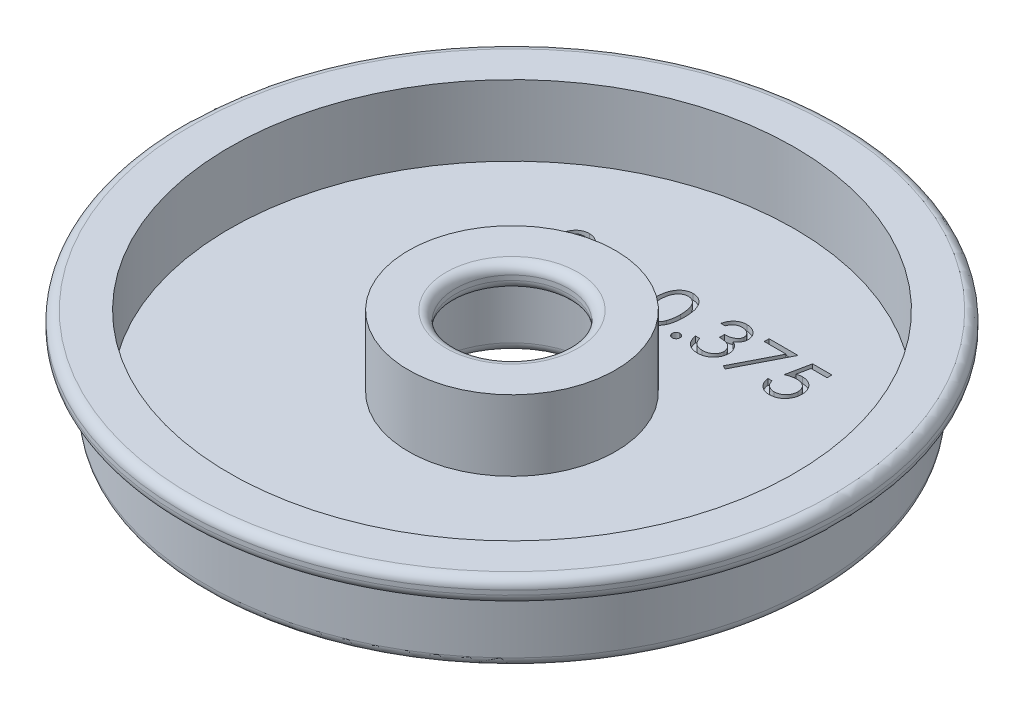
from build123d import *

# Parameters (mm, degrees)
CUT_EXTRUDE1_DEPTH = 0.79375


with BuildPart() as part:
    # Sketch1 → Revolve2 (revolve)
    with BuildSketch(Plane.XY):
        with BuildLine():
            Line((13.97, 6.386825196), (13.97, 15.911825196))
            Line((13.97, 15.911825196), (8.89, 15.911825196))
            ThreePointArc((8.89, 15.911825196), (7.991974388, 15.539850808), (7.62, 14.641825196))
            Line((7.62, 14.641825196), (7.62, 14.006825196))
            ThreePointArc((7.62, 14.006825196), (7.991974388, 13.108799584), (8.89, 12.736825196))
            Line((8.89, 12.736825196), (9.525, 12.736825196))
            ThreePointArc((9.525, 12.736825196), (10.423025612, 12.364850808), (10.795, 11.466825196))
            Line((10.795, 11.466825196), (10.795, 4.481825196))
            ThreePointArc((10.795, 4.481825196), (11.166974388, 3.583799584), (12.065, 3.211825196))
            Line((12.065, 3.211825196), (40.005, 3.211825196))
            ThreePointArc((40.005, 3.211825196), (40.903025612, 3.583799584), (41.275, 4.481825196))
            Line((41.275, 4.481825196), (41.275, 11.503650391))
            ThreePointArc((41.275, 11.503650391), (41.646974388, 12.401676004), (42.545, 12.773650391))
            Line((42.545, 12.773650391), (43.18, 12.773650391))
            ThreePointArc((43.18, 12.773650391), (44.078025612, 13.145624779), (44.45, 14.043650391))
            Line((44.45, 14.043650391), (44.45, 14.641825196))
            ThreePointArc((44.45, 14.641825196), (44.078025612, 15.539850808), (43.18, 15.911825196))
            Line((43.18, 15.911825196), (38.1, 15.911825196))
            Line((38.1, 15.911825196), (38.1, 6.386825196))
            Line((38.1, 6.386825196), (13.97, 6.386825196))
        make_face()
    revolve(axis=Axis((0, 0, 0), (0, 1, 0)))

    # Sketch2 → Cut-Extrude1 (cut)
    # profile 1 of 7: a face of its own
    with BuildSketch(Plane(origin=(0, 6.386825196, 0), x_dir=(1, 0, 0), z_dir=(0, 1, 0))):
        with BuildLine():
            Line((-14.587726894, 22.070934465), (-15.157598689, 22.070934465))
            add(Edge.make_bspline(
                [(-15.157598689, 22.070934465), (-15.142159932, 22.134856257), (-15.111978427, 22.259818133), (-15.049027115, 22.43835702), (-14.980448466, 22.607309695), (-14.898099662, 22.763512571), (-14.808276637, 22.910104866), (-14.705365413, 23.043761706), (-14.594113917, 23.167882372), (-14.47106008, 23.278033532), (-14.342012365, 23.37777884), (-14.205152412, 23.462823587), (-14.063233734, 23.535983122), (-13.91527305, 23.596254114), (-13.760829852, 23.641657564), (-13.601300393, 23.674599197), (-13.436266614, 23.695991647), (-13.324238843, 23.69807946), (-13.267354298, 23.699139593)],
                knots=[0, 0, 0, 0, 1.162005537, 2.271625781, 3.343758855, 4.383309926, 5.390229558, 6.379919256, 7.361854164, 8.333198761, 9.295911338, 10.242430842, 11.177959212, 12.116337295, 13.062827104, 14.020064771, 14.994644689, 16, 16, 16, 16], degree=3))
            add(Edge.make_bspline(
                [(-13.267354298, 23.699139593), (-13.184472751, 23.696637275), (-13.020517546, 23.691687222), (-12.779647446, 23.646485316), (-12.547370217, 23.574956862), (-12.326228296, 23.476125957), (-12.120817711, 23.354228974), (-11.938053487, 23.209150095), (-11.780412903, 23.043688505), (-11.648161675, 22.860930852), (-11.544611319, 22.665613), (-11.468254613, 22.464589857), (-11.421769563, 22.258338281), (-11.415745125, 22.119078646), (-11.412726894, 22.049309865)],
                knots=[0, 0, 0, 0, 1.083050992, 2.142477498, 3.193116406, 4.255571735, 5.30263384, 6.308962982, 7.297363603, 8.282367274, 9.249857812, 10.179914175, 11.08814088, 12, 12, 12, 12], degree=3))
            add(Edge.make_bspline(
                [(-11.412726894, 22.049309865), (-11.41483798, 21.982168966), (-11.418969049, 21.850784646), (-11.454045915, 21.658975644), (-11.513075992, 21.478197312), (-11.594845418, 21.307688632), (-11.700693659, 21.148530709), (-11.828914124, 21.000365449), (-11.98041181, 20.862535691), (-12.095217883, 20.783578933), (-12.154323448, 20.742929657)],
                knots=[0, 0, 0, 0, 1.024540389, 2.004866551, 2.965041327, 3.920577974, 4.882998113, 5.874504559, 6.905732034, 8, 8, 8, 8], degree=3))
            add(Edge.make_bspline(
                [(-12.154323448, 20.742929657), (-12.086774408, 20.710312117), (-11.952940222, 20.645687337), (-11.770512832, 20.518949034), (-11.604908687, 20.372615375), (-11.512554797, 20.258419419), (-11.466152374, 20.201042638)],
                knots=[0, 0, 0, 0, 1.015518401, 2.012035669, 3.001164323, 4, 4, 4, 4], degree=3))
            add(Edge.make_bspline(
                [(-11.466152374, 20.201042638), (-11.435597368, 20.159209288), (-11.374987713, 20.07622764), (-11.300174673, 19.942811553), (-11.232303852, 19.807916708), (-11.179417025, 19.6679275), (-11.138461581, 19.524466461), (-11.109186208, 19.377287256), (-11.090999553, 19.226269701), (-11.088395051, 19.124102773), (-11.087085868, 19.072747365)],
                knots=[0, 0, 0, 0, 1.025084078, 2.033381695, 3.024893161, 4.013698104, 4.991890475, 5.976764909, 6.982997093, 8, 8, 8, 8], degree=3))
            add(Edge.make_bspline(
                [(-11.087085868, 19.072747365), (-11.090341628, 18.983829728), (-11.096837827, 18.806412902), (-11.154902362, 18.544294478), (-11.244914956, 18.288071067), (-11.372743968, 18.043006716), (-11.528532163, 17.813716596), (-11.713874737, 17.608563864), (-11.926665792, 17.432217825), (-12.163984612, 17.284879268), (-12.421099974, 17.167099609), (-12.696101405, 17.085352534), (-12.985026503, 17.032110506), (-13.183159743, 17.026401187), (-13.283890756, 17.023498567)],
                knots=[0, 0, 0, 0, 0.955779014, 1.907060117, 2.875433937, 3.871313158, 4.872415639, 5.851225146, 6.836215519, 7.83643374, 8.849228613, 9.86973379, 10.916971861, 12, 12, 12, 12], degree=3))
            add(Edge.make_bspline(
                [(-13.283890756, 17.023498567), (-13.351780058, 17.025073754), (-13.485363566, 17.028173197), (-13.681748198, 17.049361516), (-13.869203281, 17.08806024), (-14.047982266, 17.140136237), (-14.218243975, 17.206161254), (-14.379468852, 17.288382321), (-14.532648801, 17.385104617), (-14.676338327, 17.497469841), (-14.8105203, 17.623165986), (-14.931628814, 17.764424475), (-15.041683009, 17.918634051), (-15.137736083, 18.087585882), (-15.224163125, 18.269096563), (-15.295248575, 18.465490267), (-15.35781525, 18.675011278), (-15.386904535, 18.821020893), (-15.401829458, 18.895934465)],
                knots=[0, 0, 0, 0, 1.048658725, 2.063410685, 3.046034179, 4.001477787, 4.936774919, 5.862367409, 6.792675028, 7.730719943, 8.675894397, 9.627829632, 10.600096036, 11.597688215, 12.626045268, 13.701542398, 14.82072376, 16, 16, 16, 16], degree=3))
            Line((-15.401829458, 18.895934465), (-14.831957663, 18.895934465))
            add(Edge.make_bspline(
                [(-14.831957663, 18.895934465), (-14.817110834, 18.847041255), (-14.788232463, 18.751939715), (-14.739075665, 18.615069446), (-14.6830718, 18.489596978), (-14.622992529, 18.374601885), (-14.559894491, 18.268951669), (-14.489291698, 18.175439993), (-14.416413392, 18.089959554), (-14.361477994, 18.041800044), (-14.334591878, 18.018230138)],
                knots=[0, 0, 0, 0, 1.198163088, 2.33053128, 3.407730985, 4.417276592, 5.372219308, 6.28897303, 7.162600585, 8, 8, 8, 8], degree=3))
            add(Edge.make_bspline(
                [(-14.334591878, 18.018230138), (-14.299038089, 17.990819303), (-14.228040258, 17.936082246), (-14.112346467, 17.866229291), (-13.990671602, 17.805702859), (-13.860379265, 17.759468154), (-13.724281038, 17.720320112), (-13.580177104, 17.694701456), (-13.42933881, 17.677124345), (-13.326345868, 17.675573255), (-13.273714474, 17.674780618)],
                knots=[0, 0, 0, 0, 0.946170439, 1.889420265, 2.845303464, 3.807233317, 4.801018734, 5.828864929, 6.890507805, 8, 8, 8, 8], degree=3))
            add(Edge.make_bspline(
                [(-13.273714474, 17.674780618), (-13.214290262, 17.675898046), (-13.098091345, 17.678083081), (-12.928537529, 17.698177577), (-12.767234017, 17.727442756), (-12.615971709, 17.772642025), (-12.472769217, 17.828487284), (-12.339633938, 17.898606534), (-12.214818146, 17.980874814), (-12.09992051, 18.074381574), (-11.996605089, 18.176746286), (-11.905637687, 18.283812858), (-11.828304372, 18.395129863), (-11.765922738, 18.511313311), (-11.716663882, 18.631882083), (-11.683130075, 18.757174531), (-11.659813755, 18.886165285), (-11.657914902, 18.973847843), (-11.656957663, 19.018049849)],
                knots=[0, 0, 0, 0, 1.217147791, 2.380027433, 3.494444702, 4.572153297, 5.609568379, 6.639424714, 7.649109417, 8.668170816, 9.669597737, 10.625200337, 11.543417969, 12.441394052, 13.322311151, 14.205496177, 15.095365482, 16, 16, 16, 16], degree=3))
            add(Edge.make_bspline(
                [(-11.656957663, 19.018049849), (-11.659734067, 19.077216135), (-11.66527306, 19.195254305), (-11.707561483, 19.368913332), (-11.777119137, 19.536232952), (-11.874496407, 19.694358457), (-11.993034086, 19.840909021), (-12.131581846, 19.971667282), (-12.291290203, 20.079563019), (-12.438283394, 20.154109581), (-12.568485892, 20.204976846), (-12.679910947, 20.238858567), (-12.80465507, 20.267549057), (-12.941209732, 20.294241321), (-13.090603853, 20.316958624), (-13.252674791, 20.335903061), (-13.427455387, 20.351061493), (-13.548452216, 20.357830765), (-13.610803817, 20.36131908)],
                knots=[0, 0, 0, 0, 1.07054697, 2.135767047, 3.216561865, 4.33974944, 5.486079747, 6.621378074, 7.775625952, 8.963672916, 9.598146892, 10.304877434, 11.070270905, 11.915000392, 12.823868403, 13.805723172, 14.86925407, 16, 16, 16, 16], degree=3))
            Line((-13.610803817, 20.36131908), (-13.610803817, 21.012601131))
            add(Edge.make_bspline(
                [(-13.610803817, 21.012601131), (-13.53224313, 21.013934275), (-13.378362044, 21.016545576), (-13.153582377, 21.048128681), (-12.93863794, 21.091817821), (-12.738292279, 21.158738098), (-12.555686756, 21.236462637), (-12.39726405, 21.326908788), (-12.265243654, 21.427446976), (-12.160267138, 21.539628996), (-12.081292681, 21.659943439), (-12.023549777, 21.785340804), (-11.989440613, 21.916920171), (-11.984887361, 22.00671764), (-11.982598689, 22.051853936)],
                knots=[0, 0, 0, 0, 1.321986639, 2.589447074, 3.816329219, 5.01088745, 6.139805852, 7.153945165, 8.075214402, 8.924034688, 9.728124013, 10.488707548, 11.240355623, 12, 12, 12, 12], degree=3))
            add(Edge.make_bspline(
                [(-11.982598689, 22.051853936), (-11.983350548, 22.085014988), (-11.984846338, 22.150987328), (-12.003709971, 22.247371381), (-12.032056445, 22.340808811), (-12.071026811, 22.430902267), (-12.123187886, 22.517026907), (-12.185610176, 22.599916993), (-12.259938015, 22.679099277), (-12.345110469, 22.752905), (-12.436571886, 22.823243473), (-12.536810764, 22.882958215), (-12.642804736, 22.934021399), (-12.754671153, 22.976130067), (-12.872773044, 23.007806204), (-12.996555513, 23.030549802), (-13.126254596, 23.044769547), (-13.214740452, 23.046816816), (-13.259722086, 23.047857541)],
                knots=[0, 0, 0, 0, 0.884392785, 1.759457502, 2.611959086, 3.489218968, 4.37281399, 5.2945488, 6.255912374, 7.266815255, 8.301784654, 9.332968512, 10.37626691, 11.440494194, 12.520033166, 13.637162961, 14.798855837, 16, 16, 16, 16], degree=3))
            add(Edge.make_bspline(
                [(-13.259722086, 23.047857541), (-13.332024398, 23.045333213), (-13.473247629, 23.040402613), (-13.67683755, 22.997217146), (-13.866102627, 22.928314052), (-14.010771351, 22.846067002), (-14.117601164, 22.764876929), (-14.193940752, 22.693970314), (-14.268907964, 22.615170762), (-14.337570835, 22.523624853), (-14.407010764, 22.425532248), (-14.470228754, 22.315906426), (-14.53165991, 22.197607025), (-14.568675964, 22.113976373), (-14.587726894, 22.070934465)],
                knots=[0, 0, 0, 0, 1.472543308, 2.876219568, 4.221790263, 5.565193594, 6.249813518, 6.953379497, 7.687249741, 8.463570142, 9.283606569, 10.136032583, 11.040678096, 12, 12, 12, 12], degree=3))
        make_face()
    # profile 2 of 7: a face of its own
    with BuildSketch(Plane(origin=(0, 6.386825196, 0), x_dir=(1, 0, 0), z_dir=(0, 1, 0))):
        Polygon((-8.074906381, 21.826703695), (-7.396911589, 21.826703695), (-6.202470483, 20.152705298), (-5.008029378, 21.826703695), (-4.330034586, 21.826703695), (-5.86283707, 19.678236147), (-4.085803817, 17.18631908), (-4.763798608, 17.18631908), (-6.202470483, 19.202494961), (-7.641142358, 17.18631908), (-8.31913715, 17.18631908), (-6.540831862, 19.678236147), align=None)
    # profile 3 of 7: a face of its own
    with BuildSketch(Plane(origin=(0, 6.386825196, 0), x_dir=(1, 0, 0), z_dir=(0, 1, 0))):
        with BuildLine():
            add(Edge.make_bspline(
                [(-1.399265355, 20.358775009), (-1.398670237, 20.460551699), (-1.39751421, 20.658254384), (-1.384653789, 20.946335092), (-1.363289954, 21.216591616), (-1.334012149, 21.469036893), (-1.298383242, 21.703736095), (-1.250820859, 21.920062011), (-1.196731917, 22.119015869), (-1.134043908, 22.301246443), (-1.06330892, 22.469208847), (-0.986321047, 22.626008855), (-0.90002492, 22.771409218), (-0.80935252, 22.907730637), (-0.710633476, 23.032741626), (-0.606677099, 23.1482076), (-0.493425981, 23.251459961), (-0.374729951, 23.345523967), (-0.249514366, 23.427982294), (-0.121348386, 23.50061312), (0.010650163, 23.562661451), (0.146841666, 23.611448384), (0.286002021, 23.651745206), (0.4286177, 23.679302297), (0.574924174, 23.69664126), (0.673678349, 23.698298914), (0.723761488, 23.699139593)],
                knots=[0, 0, 0, 0, 1.646270934, 3.197905019, 4.663502075, 6.030701355, 7.308322542, 8.50163776, 9.611534131, 10.641858119, 11.616356847, 12.558055219, 13.465016945, 14.349605745, 15.204443733, 16.039544428, 16.859896111, 17.680448484, 18.487036065, 19.28249412, 20.06191084, 20.843045899, 21.620316918, 22.403196591, 23.190181807, 24, 24, 24, 24], degree=3))
            add(Edge.make_bspline(
                [(0.723761488, 23.699139593), (0.774262999, 23.698254557), (0.874694615, 23.696494498), (1.023176439, 23.679578203), (1.168228004, 23.651509165), (1.309230913, 23.611738254), (1.447343388, 23.562397526), (1.581485156, 23.500553757), (1.712489433, 23.428564954), (1.838274383, 23.34397592), (1.9602209, 23.249665219), (2.075333632, 23.143052948), (2.18362306, 23.0252156), (2.286448257, 22.897413933), (2.380891983, 22.757196708), (2.470832353, 22.60700268), (2.551335904, 22.444205254), (2.628868814, 22.271520691), (2.695792348, 22.08417091), (2.756146821, 21.883211987), (2.80491295, 21.666270248), (2.845533487, 21.434483917), (2.877002084, 21.187001769), (2.899921306, 20.924354311), (2.912028189, 20.646368745), (2.914308204, 20.456308076), (2.915478235, 20.358775009)],
                knots=[0, 0, 0, 0, 0.810914788, 1.612654377, 2.396697861, 3.181598691, 3.963628158, 4.749916497, 5.551656086, 6.361998678, 7.18212741, 8.025565596, 8.878627764, 9.750805457, 10.657531673, 11.591944965, 12.560506719, 13.57287815, 14.630710178, 15.753379473, 16.941251878, 18.199788006, 19.531962791, 20.947069417, 22.433333509, 24, 24, 24, 24], degree=3))
            add(Edge.make_bspline(
                [(2.915478235, 20.358775009), (2.914296074, 20.261667348), (2.911992682, 20.072457029), (2.900057029, 19.79572226), (2.876546369, 19.534468667), (2.847136819, 19.288069685), (2.806404358, 19.057550862), (2.756320699, 18.842114506), (2.700712256, 18.640830262), (2.63206913, 18.455347103), (2.556938269, 18.283077549), (2.475195271, 18.122210009), (2.387620015, 17.971322592), (2.292209006, 17.831623051), (2.190512099, 17.702121773), (2.080352682, 17.585104658), (1.964836049, 17.477752153), (1.842530666, 17.382227057), (1.714783995, 17.298616055), (1.58422967, 17.223842355), (1.448551245, 17.163548751), (1.31082346, 17.111778034), (1.169076281, 17.072225785), (1.023486401, 17.044877504), (0.874794373, 17.025697151), (0.774280105, 17.024233966), (0.723761488, 17.023498567)],
                knots=[0, 0, 0, 0, 1.561518951, 3.042555995, 4.452378317, 5.7783523, 7.031515105, 8.214008947, 9.334062868, 10.386615937, 11.391082383, 12.354592575, 13.286541444, 14.194233754, 15.072674879, 15.931287219, 16.775624067, 17.606195743, 18.42308326, 19.229000347, 20.022332153, 20.807536673, 21.593273796, 22.3848459, 23.188221202, 24, 24, 24, 24], degree=3))
            add(Edge.make_bspline(
                [(0.723761488, 17.023498567), (0.673679738, 17.024344669), (0.574928303, 17.026013017), (0.42860176, 17.043273644), (0.286575041, 17.071024057), (0.148147302, 17.109879896), (0.012608338, 17.157441099), (-0.118194924, 17.219405639), (-0.245716865, 17.290768879), (-0.369617259, 17.372040572), (-0.487567894, 17.465152769), (-0.600232507, 17.568139407), (-0.704780756, 17.683570453), (-0.802088329, 17.809623256), (-0.894569889, 17.945138139), (-0.979640609, 18.09196533), (-1.05832773, 18.249522637), (-1.130252349, 18.41882799), (-1.194022067, 18.60235193), (-1.250351481, 18.802194011), (-1.294827166, 19.020118094), (-1.332896242, 19.254373888), (-1.363601909, 19.505968019), (-1.384564756, 19.775037074), (-1.397521142, 20.061413382), (-1.398673341, 20.257845686), (-1.399265355, 20.358775009)],
                knots=[0, 0, 0, 0, 0.810891512, 1.598919785, 2.382837074, 3.152667961, 3.926044502, 4.706494248, 5.493654104, 6.291793342, 7.103789334, 7.925228297, 8.761435821, 9.622817696, 10.50288917, 11.416980706, 12.369136599, 13.353924996, 14.394355917, 15.514179734, 16.714354668, 17.994756427, 19.357759367, 20.818452758, 22.365282078, 24, 24, 24, 24], degree=3))
        make_face()
        with BuildLine():
            add(Edge.make_bspline(
                [(-0.82939356, 20.36131908), (-0.829176849, 20.276503584), (-0.828756256, 20.111893359), (-0.817768577, 19.872692014), (-0.802800299, 19.649588704), (-0.783493946, 19.442300145), (-0.754822882, 19.251527979), (-0.72269771, 19.075960125), (-0.683603319, 18.91652571), (-0.637348072, 18.772130682), (-0.584662853, 18.640324514), (-0.527139358, 18.517676596), (-0.465343475, 18.402738082), (-0.396184445, 18.296541393), (-0.320864258, 18.198740209), (-0.241084203, 18.107603499), (-0.1538668, 18.026328976), (-0.03321001, 17.928853111), (0.12607788, 17.828125539), (0.326774991, 17.740411919), (0.533002038, 17.685289463), (0.672976449, 17.678279505), (0.742842017, 17.674780618)],
                knots=[0, 0, 0, 0, 1.459021318, 2.831673884, 4.118529203, 5.306027144, 6.411944654, 7.436330062, 8.375795394, 9.233974572, 10.042671642, 10.816086306, 11.563610507, 12.285937304, 12.993564865, 13.685989202, 14.367179055, 15.041617293, 16.353048772, 17.594441528, 18.799311195, 20, 20, 20, 20], degree=3))
            add(Edge.make_bspline(
                [(0.742842017, 17.674780618), (0.813159507, 17.677679449), (0.953649307, 17.683471126), (1.158906336, 17.739348835), (1.358169826, 17.823657857), (1.514328917, 17.923348331), (1.63313296, 18.018286872), (1.718253785, 18.099230591), (1.796380645, 18.189864807), (1.870479838, 18.28765353), (1.938441303, 18.394465037), (2.000241568, 18.509785709), (2.056635641, 18.633935789), (2.08876491, 18.720603744), (2.105191776, 18.764914833)],
                knots=[0, 0, 0, 0, 1.353760809, 2.704726607, 4.075137775, 5.516104923, 6.260822281, 7.007110065, 7.778089737, 8.566572457, 9.372053459, 10.217411131, 11.088608312, 12, 12, 12, 12], degree=3))
            add(Edge.make_bspline(
                [(2.105191776, 18.764914833), (2.124335698, 18.821574503), (2.163206069, 18.936617933), (2.213301716, 19.115077701), (2.252754083, 19.302317002), (2.288247618, 19.497216856), (2.312473877, 19.7012146), (2.331973481, 19.913679039), (2.343459156, 20.134770368), (2.344882919, 20.284984137), (2.34560644, 20.36131908)],
                knots=[0, 0, 0, 0, 0.884706709, 1.796334032, 2.740027952, 3.714592787, 4.726048262, 5.777819803, 6.87074269, 8, 8, 8, 8], degree=3))
            add(Edge.make_bspline(
                [(2.34560644, 20.36131908), (2.344608239, 20.437641676), (2.342655546, 20.586944989), (2.335191597, 20.805599402), (2.315917397, 21.013276626), (2.294510424, 21.210871341), (2.262946895, 21.397289747), (2.228914874, 21.574092444), (2.183192674, 21.739089074), (2.134352511, 21.894862887), (2.078453651, 22.039644074), (2.016920818, 22.174107658), (1.951204199, 22.298902802), (1.879826134, 22.41368711), (1.803633966, 22.518974723), (1.720616698, 22.612654631), (1.634067336, 22.697630273), (1.512841871, 22.794626648), (1.354138516, 22.893526439), (1.156661413, 22.98454146), (0.951156101, 23.036807934), (0.812229978, 23.044176995), (0.742842017, 23.047857541)],
                knots=[0, 0, 0, 0, 1.31362396, 2.569729283, 3.763502607, 4.902122613, 5.988968491, 7.01645872, 7.998833611, 8.933434873, 9.825090667, 10.667526885, 11.477055099, 12.250526234, 12.991942729, 13.710640831, 14.402115721, 15.076753259, 16.378508321, 17.609869233, 18.806226677, 20, 20, 20, 20], degree=3))
            add(Edge.make_bspline(
                [(0.742842017, 23.047857541), (0.672609942, 23.044171917), (0.532017848, 23.036793953), (0.324376559, 22.984736193), (0.125341521, 22.893998384), (-0.032942162, 22.794299079), (-0.154252175, 22.699342428), (-0.239673633, 22.616998433), (-0.319767402, 22.526925943), (-0.39355023, 22.428225326), (-0.462655072, 22.322152445), (-0.526120623, 22.207872829), (-0.583302064, 22.084807354), (-0.636069723, 21.953060393), (-0.682466067, 21.808677822), (-0.720736543, 21.649439791), (-0.756091625, 21.474430359), (-0.781120184, 21.282624966), (-0.803370141, 21.075284488), (-0.817669158, 20.85162421), (-0.828793011, 20.612021692), (-0.829189368, 20.446560361), (-0.82939356, 20.36131908)],
                knots=[0, 0, 0, 0, 1.207732386, 2.417664972, 3.655092373, 4.956220595, 5.625982001, 6.301752483, 6.994047911, 7.697131622, 8.419323945, 9.170223765, 9.943494443, 10.752040957, 11.610060368, 12.549350801, 13.567764191, 14.679664412, 15.874934091, 17.154273443, 18.533957287, 20, 20, 20, 20], degree=3))
        make_face(mode=Mode.SUBTRACT)
    # profile 4 of 7: a face of its own
    with BuildSketch(Plane(origin=(0, 6.386825196, 0), x_dir=(1, 0, 0), z_dir=(0, 1, 0))):
        with BuildLine():
            add(Edge.make_bspline(
                [(4.502978235, 18.163242157), (4.538339048, 18.161140912), (4.607659789, 18.157021666), (4.70787935, 18.128761129), (4.798583947, 18.078580417), (4.879378163, 18.011700804), (4.945974199, 17.930610101), (4.997943238, 17.840628953), (5.025957597, 17.739570349), (5.030046837, 17.669847939), (5.032144901, 17.63407549)],
                knots=[0, 0, 0, 0, 1.020151414, 1.999887582, 2.974338812, 3.990962822, 5.007586832, 5.987933904, 6.967670073, 8, 8, 8, 8], degree=3))
            add(Edge.make_bspline(
                [(5.032144901, 17.63407549), (5.02997574, 17.599162592), (5.025698186, 17.530314869), (4.998007454, 17.430018501), (4.945578134, 17.339981117), (4.879837504, 17.257790095), (4.798563974, 17.190768802), (4.70766491, 17.141015019), (4.607895056, 17.110730998), (4.538378298, 17.106873288), (4.502978235, 17.104908824)],
                knots=[0, 0, 0, 0, 1.009421747, 1.99056486, 2.972319754, 3.999869655, 5.017953583, 5.993804169, 6.978383603, 8, 8, 8, 8], degree=3))
            add(Edge.make_bspline(
                [(4.502978235, 17.104908824), (4.467552663, 17.106802207), (4.398392667, 17.110498587), (4.298995221, 17.141636822), (4.207542578, 17.190302242), (4.126284872, 17.257915064), (4.059993645, 17.339558181), (4.009873308, 17.430638583), (3.979774037, 17.530027763), (3.975815497, 17.599106043), (3.973811568, 17.63407549)],
                knots=[0, 0, 0, 0, 1.022052826, 1.995314843, 2.982371812, 4.00089066, 5.028879526, 6.005146991, 6.990147033, 8, 8, 8, 8], degree=3))
            add(Edge.make_bspline(
                [(3.973811568, 17.63407549), (3.975738519, 17.669906508), (3.979500656, 17.739862172), (4.009936496, 17.840009124), (4.059604767, 17.931029006), (4.126743126, 18.011577087), (4.20752292, 18.079045479), (4.298774607, 18.128148747), (4.398632058, 18.157250638), (4.467592947, 18.161210347), (4.502978235, 18.163242157)],
                knots=[0, 0, 0, 0, 1.032775665, 2.016367738, 2.991239715, 4.008302682, 5.025365648, 6.011011707, 6.979408107, 8, 8, 8, 8], degree=3))
        make_face()
    # profile 5 of 7: a face of its own
    with BuildSketch(Plane(origin=(0, 6.386825196, 0), x_dir=(1, 0, 0), z_dir=(0, 1, 0))):
        with BuildLine():
            Line((6.660350029, 22.070934465), (6.090478235, 22.070934465))
            add(Edge.make_bspline(
                [(6.090478235, 22.070934465), (6.105916991, 22.134856257), (6.136098496, 22.259818133), (6.199049808, 22.43835702), (6.267628457, 22.607309695), (6.349977261, 22.763512571), (6.439800287, 22.910104866), (6.54271151, 23.043761706), (6.653963007, 23.167882372), (6.777016843, 23.278033532), (6.906064558, 23.37777884), (7.042924511, 23.462823587), (7.184843189, 23.535983122), (7.332803873, 23.596254114), (7.487247071, 23.641657564), (7.64677653, 23.674599197), (7.811810309, 23.695991647), (7.92383808, 23.69807946), (7.980722626, 23.699139593)],
                knots=[0, 0, 0, 0, 1.162005537, 2.271625781, 3.343758855, 4.383309926, 5.390229558, 6.379919256, 7.361854164, 8.333198761, 9.295911338, 10.242430842, 11.177959212, 12.116337295, 13.062827104, 14.020064771, 14.994644689, 16, 16, 16, 16], degree=3))
            add(Edge.make_bspline(
                [(7.980722626, 23.699139593), (8.063604172, 23.696637275), (8.227559377, 23.691687222), (8.468429477, 23.646485316), (8.700706706, 23.574956862), (8.921848627, 23.476125957), (9.127259212, 23.354228974), (9.310023436, 23.209150095), (9.46766402, 23.043688505), (9.599915248, 22.860930852), (9.703465604, 22.665613), (9.77982231, 22.464589857), (9.82630736, 22.258338281), (9.832331798, 22.119078646), (9.835350029, 22.049309865)],
                knots=[0, 0, 0, 0, 1.083050992, 2.142477498, 3.193116406, 4.255571735, 5.30263384, 6.308962982, 7.297363603, 8.282367274, 9.249857812, 10.179914175, 11.08814088, 12, 12, 12, 12], degree=3))
            add(Edge.make_bspline(
                [(9.835350029, 22.049309865), (9.833238943, 21.982168966), (9.829107874, 21.850784646), (9.794031008, 21.658975644), (9.735000931, 21.478197312), (9.653231505, 21.307688632), (9.547383264, 21.148530709), (9.419162799, 21.000365449), (9.267665113, 20.862535691), (9.15285904, 20.783578933), (9.093753475, 20.742929657)],
                knots=[0, 0, 0, 0, 1.024540389, 2.004866551, 2.965041327, 3.920577974, 4.882998113, 5.874504559, 6.905732034, 8, 8, 8, 8], degree=3))
            add(Edge.make_bspline(
                [(9.093753475, 20.742929657), (9.161302515, 20.710312117), (9.295136702, 20.645687337), (9.477564091, 20.518949034), (9.643168236, 20.372615375), (9.735522126, 20.258419419), (9.781924549, 20.201042638)],
                knots=[0, 0, 0, 0, 1.015518401, 2.012035669, 3.001164323, 4, 4, 4, 4], degree=3))
            add(Edge.make_bspline(
                [(9.781924549, 20.201042638), (9.812479555, 20.159209288), (9.87308921, 20.07622764), (9.94790225, 19.942811553), (10.015773071, 19.807916708), (10.068659898, 19.6679275), (10.109615342, 19.524466461), (10.138890715, 19.377287256), (10.15707737, 19.226269701), (10.159681872, 19.124102773), (10.160991055, 19.072747365)],
                knots=[0, 0, 0, 0, 1.025084078, 2.033381695, 3.024893161, 4.013698104, 4.991890475, 5.976764909, 6.982997093, 8, 8, 8, 8], degree=3))
            add(Edge.make_bspline(
                [(10.160991055, 19.072747365), (10.157735295, 18.983829728), (10.151239096, 18.806412902), (10.093174561, 18.544294478), (10.003161967, 18.288071067), (9.875332955, 18.043006716), (9.71954476, 17.813716596), (9.534202186, 17.608563864), (9.321411131, 17.432217825), (9.084092311, 17.284879268), (8.826976949, 17.167099609), (8.551975518, 17.085352534), (8.26305042, 17.032110506), (8.064917181, 17.026401187), (7.964186167, 17.023498567)],
                knots=[0, 0, 0, 0, 0.955779014, 1.907060117, 2.875433937, 3.871313158, 4.872415639, 5.851225146, 6.836215519, 7.83643374, 8.849228613, 9.86973379, 10.916971861, 12, 12, 12, 12], degree=3))
            add(Edge.make_bspline(
                [(7.964186167, 17.023498567), (7.896296865, 17.025073754), (7.762713358, 17.028173197), (7.566328725, 17.049361516), (7.378873642, 17.08806024), (7.200094657, 17.140136237), (7.029832948, 17.206161254), (6.868608071, 17.288382321), (6.715428122, 17.385104617), (6.571738596, 17.497469841), (6.437556623, 17.623165986), (6.316448109, 17.764424475), (6.206393914, 17.918634051), (6.110340841, 18.087585882), (6.023913798, 18.269096563), (5.952828348, 18.465490267), (5.890261673, 18.675011278), (5.861172388, 18.821020893), (5.846247465, 18.895934465)],
                knots=[0, 0, 0, 0, 1.048658725, 2.063410685, 3.046034179, 4.001477787, 4.936774919, 5.862367409, 6.792675028, 7.730719943, 8.675894397, 9.627829632, 10.600096036, 11.597688215, 12.626045268, 13.701542398, 14.82072376, 16, 16, 16, 16], degree=3))
            Line((5.846247465, 18.895934465), (6.41611926, 18.895934465))
            add(Edge.make_bspline(
                [(6.41611926, 18.895934465), (6.430966089, 18.847041255), (6.45984446, 18.751939715), (6.509001258, 18.615069446), (6.565005123, 18.489596978), (6.625084394, 18.374601885), (6.688182432, 18.268951669), (6.758785225, 18.175439993), (6.831663531, 18.089959554), (6.886598929, 18.041800044), (6.913485045, 18.018230138)],
                knots=[0, 0, 0, 0, 1.198163088, 2.33053128, 3.407730985, 4.417276592, 5.372219308, 6.28897303, 7.162600585, 8, 8, 8, 8], degree=3))
            add(Edge.make_bspline(
                [(6.913485045, 18.018230138), (6.949038834, 17.990819303), (7.020036666, 17.936082246), (7.135730456, 17.866229291), (7.257405321, 17.805702859), (7.387697658, 17.759468154), (7.523795885, 17.720320112), (7.667899819, 17.694701456), (7.818738113, 17.677124345), (7.921731055, 17.675573255), (7.974362449, 17.674780618)],
                knots=[0, 0, 0, 0, 0.946170439, 1.889420265, 2.845303464, 3.807233317, 4.801018734, 5.828864929, 6.890507805, 8, 8, 8, 8], degree=3))
            add(Edge.make_bspline(
                [(7.974362449, 17.674780618), (8.033786661, 17.675898046), (8.149985578, 17.678083081), (8.319539394, 17.698177577), (8.480842906, 17.727442756), (8.632105214, 17.772642025), (8.775307706, 17.828487284), (8.908442985, 17.898606534), (9.033258777, 17.980874814), (9.148156413, 18.074381574), (9.251471834, 18.176746286), (9.342439236, 18.283812858), (9.419772551, 18.395129863), (9.482154185, 18.511313311), (9.531413041, 18.631882083), (9.564946848, 18.757174531), (9.588263168, 18.886165285), (9.590162022, 18.973847843), (9.59111926, 19.018049849)],
                knots=[0, 0, 0, 0, 1.217147791, 2.380027433, 3.494444702, 4.572153297, 5.609568379, 6.639424714, 7.649109417, 8.668170816, 9.669597737, 10.625200337, 11.543417969, 12.441394052, 13.322311151, 14.205496177, 15.095365482, 16, 16, 16, 16], degree=3))
            add(Edge.make_bspline(
                [(9.59111926, 19.018049849), (9.588342856, 19.077216135), (9.582803863, 19.195254305), (9.54051544, 19.368913332), (9.470957786, 19.536232952), (9.373580516, 19.694358457), (9.255042837, 19.840909021), (9.116495077, 19.971667282), (8.95678672, 20.079563019), (8.809793529, 20.154109581), (8.679591031, 20.204976846), (8.568165976, 20.238858567), (8.443421853, 20.267549057), (8.306867191, 20.294241321), (8.15747307, 20.316958624), (7.995402132, 20.335903061), (7.820621536, 20.351061493), (7.699624707, 20.357830765), (7.637273106, 20.36131908)],
                knots=[0, 0, 0, 0, 1.07054697, 2.135767047, 3.216561865, 4.33974944, 5.486079747, 6.621378074, 7.775625952, 8.963672916, 9.598146892, 10.304877434, 11.070270905, 11.915000392, 12.823868403, 13.805723172, 14.86925407, 16, 16, 16, 16], degree=3))
            Line((7.637273106, 20.36131908), (7.637273106, 21.012601131))
            add(Edge.make_bspline(
                [(7.637273106, 21.012601131), (7.715833793, 21.013934275), (7.869714879, 21.016545576), (8.094494546, 21.048128681), (8.309438984, 21.091817821), (8.509784644, 21.158738098), (8.692390167, 21.236462637), (8.850812873, 21.326908788), (8.982833269, 21.427446976), (9.087809785, 21.539628996), (9.166784242, 21.659943439), (9.224527146, 21.785340804), (9.25863631, 21.916920171), (9.263189562, 22.00671764), (9.265478235, 22.051853936)],
                knots=[0, 0, 0, 0, 1.321986639, 2.589447074, 3.816329219, 5.01088745, 6.139805852, 7.153945165, 8.075214402, 8.924034688, 9.728124013, 10.488707548, 11.240355623, 12, 12, 12, 12], degree=3))
            add(Edge.make_bspline(
                [(9.265478235, 22.051853936), (9.264726375, 22.085014988), (9.263230585, 22.150987328), (9.244366953, 22.247371381), (9.216020478, 22.340808811), (9.177050112, 22.430902267), (9.124889037, 22.517026907), (9.062466748, 22.599916993), (8.988138908, 22.679099277), (8.902966455, 22.752905), (8.811505037, 22.823243473), (8.711266159, 22.882958215), (8.605272187, 22.934021399), (8.49340577, 22.976130067), (8.375303879, 23.007806204), (8.25152141, 23.030549802), (8.121822327, 23.044769547), (8.033336471, 23.046816816), (7.988354837, 23.047857541)],
                knots=[0, 0, 0, 0, 0.884392785, 1.759457502, 2.611959086, 3.489218968, 4.37281399, 5.2945488, 6.255912374, 7.266815255, 8.301784654, 9.332968512, 10.37626691, 11.440494194, 12.520033166, 13.637162961, 14.798855837, 16, 16, 16, 16], degree=3))
            add(Edge.make_bspline(
                [(7.988354837, 23.047857541), (7.916052525, 23.045333213), (7.774829294, 23.040402613), (7.571239373, 22.997217146), (7.381974296, 22.928314052), (7.237305572, 22.846067002), (7.130475759, 22.764876929), (7.054136171, 22.693970314), (6.979168959, 22.615170762), (6.910506088, 22.523624853), (6.841066159, 22.425532248), (6.777848169, 22.315906426), (6.716417013, 22.197607025), (6.679400959, 22.113976373), (6.660350029, 22.070934465)],
                knots=[0, 0, 0, 0, 1.472543308, 2.876219568, 4.221790263, 5.565193594, 6.249813518, 6.953379497, 7.687249741, 8.463570142, 9.283606569, 10.136032583, 11.040678096, 12, 12, 12, 12], degree=3))
        make_face()
    # profile 6 of 7: a face of its own
    with BuildSketch(Plane(origin=(0, 6.386825196, 0), x_dir=(1, 0, 0), z_dir=(0, 1, 0))):
        Polygon((11.137914132, 23.53631908), (15.04560644, 23.53631908), (11.707785927, 17.023498567), (11.215508283, 17.294442077), (14.081403715, 22.885037029), (11.137914132, 22.885037029), align=None)
    # profile 7 of 7: a face of its own
    with BuildSketch(Plane(origin=(0, 6.386825196, 0), x_dir=(1, 0, 0), z_dir=(0, 1, 0))):
        with BuildLine():
            Line((19.604580799, 23.53631908), (19.604580799, 22.885037029))
            Line((19.604580799, 22.885037029), (17.444664933, 22.885037029))
            Line((17.444664933, 22.885037029), (17.102487449, 21.214854737))
            add(Edge.make_bspline(
                [(17.102487449, 21.214854737), (17.169717393, 21.233415373), (17.299964775, 21.26937367), (17.492206237, 21.309298425), (17.674709235, 21.33336573), (17.793137407, 21.336651965), (17.85044418, 21.338242157)],
                knots=[0, 0, 0, 0, 1.100273476, 2.13160584, 3.095893838, 4, 4, 4, 4], degree=3))
            add(Edge.make_bspline(
                [(17.85044418, 21.338242157), (17.921353251, 21.336707388), (18.0607782, 21.333689648), (18.264774575, 21.30471215), (18.45950711, 21.259101162), (18.644568553, 21.195382501), (18.820301267, 21.113903414), (18.985088414, 21.012122094), (19.141403485, 20.893225907), (19.286442191, 20.756528528), (19.418022007, 20.606085024), (19.533711731, 20.444327172), (19.631978145, 20.272826985), (19.7110098, 20.08994588), (19.774118521, 19.897705702), (19.816122854, 19.694083731), (19.844093169, 19.480999284), (19.84721807, 19.33530385), (19.848811568, 19.261008583)],
                knots=[0, 0, 0, 0, 1.052922333, 2.070308379, 3.05430497, 4.020497103, 4.973039431, 5.925935799, 6.892292201, 7.88610001, 8.88166317, 9.857072816, 10.836096531, 11.812156883, 12.81219415, 13.836441305, 14.89672472, 16, 16, 16, 16], degree=3))
            add(Edge.make_bspline(
                [(19.848811568, 19.261008583), (19.847604931, 19.209261126), (19.845207965, 19.106465534), (19.833018527, 18.953803913), (19.809549442, 18.804374202), (19.778039429, 18.658156577), (19.737141042, 18.515427858), (19.687630901, 18.375779515), (19.627040965, 18.240080728), (19.560581185, 18.107047512), (19.485748289, 17.979687363), (19.402692997, 17.860581345), (19.314944177, 17.74794272), (19.220526235, 17.642979518), (19.118561572, 17.546381471), (19.010285061, 17.457575304), (18.896560699, 17.375059176), (18.775629045, 17.302182593), (18.650184826, 17.23512123), (18.51841649, 17.180105669), (18.383323504, 17.130919425), (18.242961516, 17.091713568), (18.097648456, 17.060993076), (17.947144792, 17.040127701), (17.792239862, 17.02493045), (17.687238053, 17.023979117), (17.634198186, 17.023498567)],
                knots=[0, 0, 0, 0, 1.056347294, 2.098418968, 3.122841568, 4.141288669, 5.149314143, 6.15115421, 7.162517403, 8.180376062, 9.185164535, 10.17417709, 11.141909838, 12.097768115, 13.052685741, 14.0056014, 14.954263652, 15.917497458, 16.885230207, 17.854509472, 18.828990115, 19.81800267, 20.826176721, 21.857883937, 22.917946725, 24, 24, 24, 24], degree=3))
            add(Edge.make_bspline(
                [(17.634198186, 17.023498567), (17.570926459, 17.024751945), (17.446446809, 17.027217817), (17.26407378, 17.053014211), (17.088605852, 17.089960174), (16.921455526, 17.145543121), (16.761124805, 17.215188641), (16.60977216, 17.303210838), (16.463530252, 17.40295864), (16.328344128, 17.520670138), (16.202875179, 17.649331447), (16.090559084, 17.788954596), (15.990531024, 17.937235155), (15.904392826, 18.094893235), (15.830917844, 18.261514569), (15.773196365, 18.437723442), (15.726608493, 18.622599164), (15.706899144, 18.749877675), (15.696888491, 18.814524208)],
                knots=[0, 0, 0, 0, 1.0467383, 2.05933395, 3.04377827, 4.011590433, 4.970194871, 5.932262533, 6.905835911, 7.896367577, 8.894135286, 9.877477877, 10.858688626, 11.851381753, 12.8477658, 13.868841284, 14.917554742, 16, 16, 16, 16], degree=3))
            Line((15.696888491, 18.814524208), (16.266760286, 18.814524208))
            add(Edge.make_bspline(
                [(16.266760286, 18.814524208), (16.280782097, 18.753969787), (16.307732797, 18.637580828), (16.366888941, 18.474056823), (16.439217029, 18.328334803), (16.525222062, 18.19848713), (16.627819974, 18.085259378), (16.744894795, 17.984354137), (16.876154236, 17.893322117), (17.022010524, 17.817443668), (17.175885682, 17.752730358), (17.336934763, 17.709637997), (17.500772649, 17.679337806), (17.611586263, 17.676304754), (17.667271103, 17.674780618)],
                knots=[0, 0, 0, 0, 1.136247022, 2.183929868, 3.172523383, 4.106158343, 5.02341133, 5.958108904, 6.928429099, 7.938127109, 8.96079061, 9.975095812, 10.982467395, 12, 12, 12, 12], degree=3))
            add(Edge.make_bspline(
                [(17.667271103, 17.674780618), (17.721624281, 17.676269744), (17.828646133, 17.679201845), (17.986146791, 17.701769766), (18.138207292, 17.736527074), (18.28332721, 17.788542383), (18.424046004, 17.851760658), (18.55680413, 17.932886581), (18.685442207, 18.026249757), (18.805961821, 18.133213929), (18.916341964, 18.251087518), (19.013870927, 18.37713936), (19.095109041, 18.511608496), (19.163569496, 18.65216693), (19.215554767, 18.80035517), (19.252640547, 18.95547873), (19.274417525, 19.117920766), (19.277413237, 19.228717942), (19.278939773, 19.285177253)],
                knots=[0, 0, 0, 0, 1.027316725, 2.022795036, 3.002884548, 3.971462791, 4.93288096, 5.914575861, 6.907176829, 7.935150275, 8.956128384, 9.956726525, 10.942570165, 11.921478529, 12.907843606, 13.90538589, 14.932640048, 16, 16, 16, 16], degree=3))
            add(Edge.make_bspline(
                [(19.278939773, 19.285177253), (19.277745103, 19.336114688), (19.275406707, 19.43581747), (19.256301244, 19.581684601), (19.223069022, 19.719702835), (19.17694284, 19.85053866), (19.11837859, 19.974315477), (19.046811709, 20.091161029), (18.960899116, 20.199535269), (18.862760975, 20.299488902), (18.755249958, 20.391736032), (18.636516311, 20.470374589), (18.509044729, 20.536530554), (18.374371028, 20.593622494), (18.229291854, 20.634626703), (18.07668025, 20.665411295), (17.914888223, 20.683219168), (17.804269974, 20.685690022), (17.747409324, 20.686960106)],
                knots=[0, 0, 0, 0, 1.045622112, 2.046656509, 3.013763289, 3.955457236, 4.890082067, 5.820317437, 6.762574623, 7.722996705, 8.69280354, 9.665887285, 10.63943826, 11.638615906, 12.663482002, 13.728887084, 14.832589034, 16, 16, 16, 16], degree=3))
            add(Edge.make_bspline(
                [(17.747409324, 20.686960106), (17.698189696, 20.685906747), (17.596563652, 20.68373183), (17.440675095, 20.667718043), (17.276860111, 20.641883894), (17.10574667, 20.606348845), (16.926820891, 20.559846749), (16.740460364, 20.504121869), (16.546273251, 20.437497671), (16.415431094, 20.387183512), (16.348170542, 20.36131908)],
                knots=[0, 0, 0, 0, 0.817624296, 1.688186739, 2.600797293, 3.572016777, 4.590301741, 5.671205678, 6.80286297, 8, 8, 8, 8], degree=3))
            Line((16.348170542, 20.36131908), (16.999452594, 23.53631908))
            Line((16.999452594, 23.53631908), (19.604580799, 23.53631908))
        make_face()
    extrude(amount=-CUT_EXTRUDE1_DEPTH, mode=Mode.SUBTRACT)


solid = part.part
